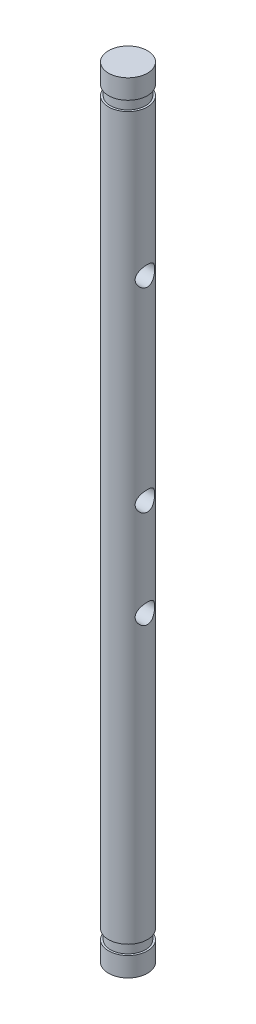
from build123d import *

# Parameters (mm, degrees)
CROQUIS1_R                 = 2
SALIENTE_EXTRUIR1_DEPTH    = 80
CROQUIS2_W                 = 6.531234996
CROQUIS2_H                 = 1
CORTAR_EXTRUIR1_DEPTH      = 81.049984385
CORTAR_EXTRUIR1_DEPTH_BACK = 81.049984385
CROQUIS3_R                 = 1


with BuildPart() as part:
    # Croquis1 → Saliente-Extruir1 (new body)
    with BuildSketch(Plane(origin=(0, 0, 0), x_dir=(1, 0, 0), z_dir=(0, 1, 0))):
        Circle(CROQUIS1_R)
    extrude(amount=SALIENTE_EXTRUIR1_DEPTH)

    # Croquis2 → Cortar-Revolución1 (revolve, cut)
    with BuildSketch(Plane.XY):
        with Locations((5.065617498, 77.5)):
            Rectangle(CROQUIS2_W, CROQUIS2_H)
        with Locations((5.065617498, 2.5)):
            Rectangle(CROQUIS2_W, CROQUIS2_H)
    revolve(axis=Axis((0, 80, 0), (0, -1, 0)), mode=Mode.SUBTRACT)

    # Croquis3 → Cortar-Extruir1 (cut, two sides: drawn at the far end of the back side and taken through both)
    with BuildSketch(Plane(origin=(0, 0, 0), x_dir=(0, 0, -1), z_dir=(1, 0, 0)).offset(-CORTAR_EXTRUIR1_DEPTH_BACK)):
        with Locations((0, 42)):
            Circle(CROQUIS3_R)
        with Locations((0, 32)):
            Circle(CROQUIS3_R)
        with Locations((0, 62)):
            Circle(CROQUIS3_R)
    extrude(amount=CORTAR_EXTRUIR1_DEPTH + CORTAR_EXTRUIR1_DEPTH_BACK, mode=Mode.SUBTRACT)


solid = part.part
